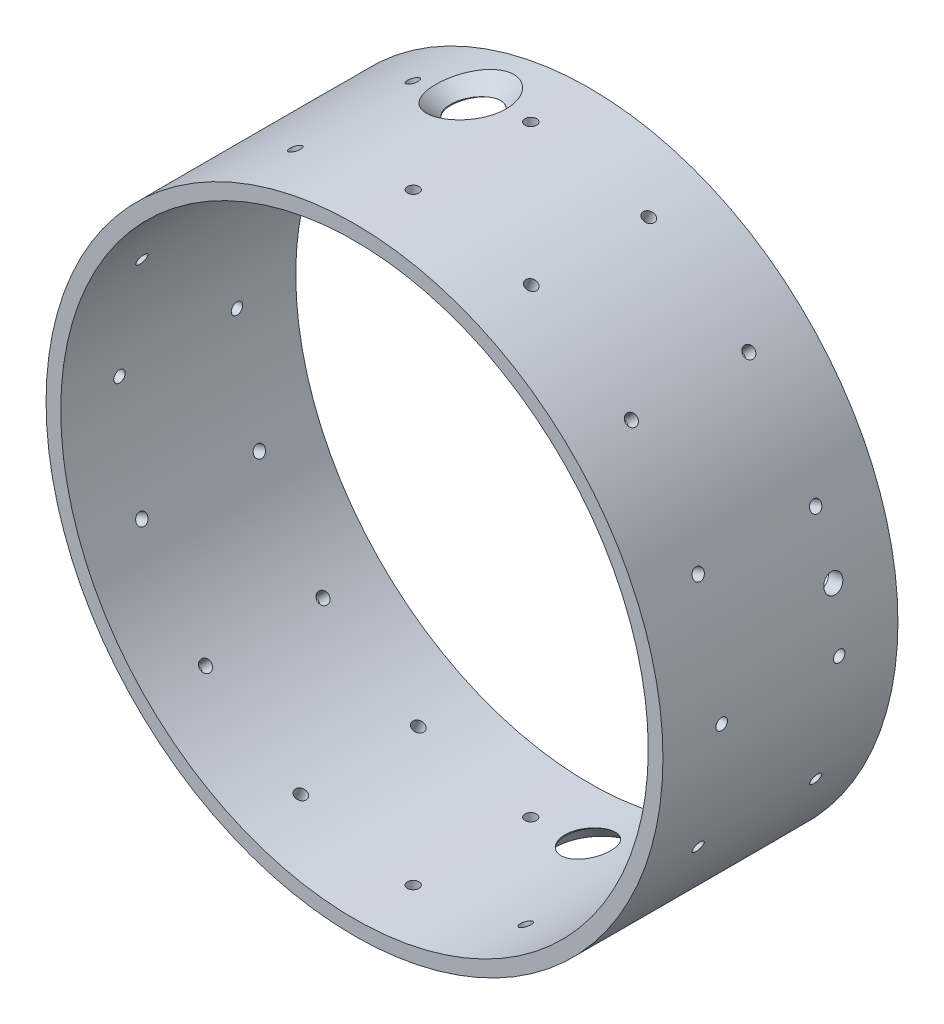
from build123d import *
from build123d.topology import SkipClean

# Parameters (mm, degrees)
SKETCH1_R                            = 66.675
SKETCH1_R_2                          = 63.5
EXTRUDE1_DEPTH                       = 50.8
F_40_0_098_DIAMETER_HOLE2_AT_2_COUNT = 2
F_40_0_098_DIAMETER_HOLE2_AT_2_PITCH = 25.4
CIRPATTERN1_COUNT                    = 16
F_10_32_TAPPED_HOLE1_D               = 4.0386
F_10_32_TAPPED_HOLE1_DEPTH           = 13.716
F_10_32_TAPPED_HOLE1_TIP             = 1.213317848


with BuildPart() as part:
    # Sketch1 → Extrude1 (new body)
    with BuildSketch(Plane.XY):
        Circle(SKETCH1_R)
        Circle(SKETCH1_R_2, mode=Mode.SUBTRACT)
    extrude(amount=EXTRUDE1_DEPTH)

    # Sketch8 → #40 (0.098) Diameter Hole2 (revolve, cut)
    with BuildSketch(Plane(origin=(0, 66.675, 12.7), x_dir=(0, 0, 1), z_dir=(1, 0, 0))):
        Polygon((0, 0), (0, 13.447831126), (1.2446, 12.7), (1.2446, 0), align=None)
    f_40_0_098_diameter_hole2 = revolve(axis=Axis((0, 73.025, 12.7), (0, -1, 0)), mode=Mode.SUBTRACT)

    # #40 (0.098) Diameter Hole2 at 2: #40 (0.098) Diameter Hole2 ×2
    with Locations(*[(0, 0, i * F_40_0_098_DIAMETER_HOLE2_AT_2_PITCH) for i in range(1, F_40_0_098_DIAMETER_HOLE2_AT_2_COUNT)]):
        add(f_40_0_098_diameter_hole2, mode=Mode.SUBTRACT)

    # CirPattern1: #40 (0.098) Diameter Hole2 ×16 about axis
    cirpattern1_axis = Axis((0, 0, 50.8), (0, 0, -1))
    for i in range(1, CIRPATTERN1_COUNT):
        add(f_40_0_098_diameter_hole2.rotate(cirpattern1_axis, i * 360 / CIRPATTERN1_COUNT), mode=Mode.SUBTRACT)

    # CirPattern1 copy 1 sketch → CirPattern1 copy 1 (revolve, cut)
    with BuildSketch(Plane(origin=(25.515417853, 61.59966783, 38.1), x_dir=(0, 0, 1), z_dir=(0.9238795325112867, -0.3826834323650898, 0))):
        Polygon((0, 0), (0, 13.447831126), (1.2446, 12.7), (1.2446, 0), align=None)
    revolve(axis=Axis((27.945457648, 67.466302862, 38.1), (-0.3826834323650898, -0.9238795325112867, 0)), mode=Mode.SUBTRACT)

    # CirPattern1 copy 2 sketch → CirPattern1 copy 2 (revolve, cut)
    with BuildSketch(Plane(origin=(47.146344636, 47.146344636, 38.1), x_dir=(0, 0, 1), z_dir=(0.7071067811865476, -0.7071067811865475, 0))):
        Polygon((0, 0), (0, 13.447831126), (1.2446, 12.7), (1.2446, 0), align=None)
    revolve(axis=Axis((51.636472696, 51.636472696, 38.1), (-0.7071067811865475, -0.7071067811865476, 0)), mode=Mode.SUBTRACT)

    # CirPattern1 copy 3 sketch → CirPattern1 copy 3 (revolve, cut)
    with BuildSketch(Plane(origin=(61.59966783, 25.515417853, 38.1), x_dir=(0, 0, 1), z_dir=(0.38268343236508984, -0.9238795325112867, 0))):
        Polygon((0, 0), (0, 13.447831126), (1.2446, 12.7), (1.2446, 0), align=None)
    revolve(axis=Axis((67.466302862, 27.945457648, 38.1), (-0.9238795325112867, -0.38268343236508984, 0)), mode=Mode.SUBTRACT)

    # CirPattern1 copy 4 sketch → CirPattern1 copy 4 (revolve, cut)
    with BuildSketch(Plane(origin=(66.675, 0, 38.1), x_dir=(0, 0, 1), z_dir=(0, -1, 0))):
        Polygon((0, 0), (0, 13.447831126), (1.2446, 12.7), (1.2446, 0), align=None)
    revolve(axis=Axis((73.025, 0, 38.1), (-1, 0, 0)), mode=Mode.SUBTRACT)

    # CirPattern1 copy 5 sketch → CirPattern1 copy 5 (revolve, cut)
    with BuildSketch(Plane(origin=(61.59966783, -25.515417853, 38.1), x_dir=(0, 0, 1), z_dir=(-0.3826834323650897, -0.9238795325112867, 0))):
        Polygon((0, 0), (0, 13.447831126), (1.2446, 12.7), (1.2446, 0), align=None)
    revolve(axis=Axis((67.466302862, -27.945457648, 38.1), (-0.9238795325112867, 0.3826834323650897, 0)), mode=Mode.SUBTRACT)

    # CirPattern1 copy 6 sketch → CirPattern1 copy 6 (revolve, cut)
    with BuildSketch(Plane(origin=(47.146344636, -47.146344636, 38.1), x_dir=(0, 0, 1), z_dir=(-0.7071067811865475, -0.7071067811865476, 0))):
        Polygon((0, 0), (0, 13.447831126), (1.2446, 12.7), (1.2446, 0), align=None)
    revolve(axis=Axis((51.636472696, -51.636472696, 38.1), (-0.7071067811865476, 0.7071067811865475, 0)), mode=Mode.SUBTRACT)

    # CirPattern1 copy 7 sketch → CirPattern1 copy 7 (revolve, cut)
    with BuildSketch(Plane(origin=(25.515417853, -61.59966783, 38.1), x_dir=(0, 0, 1), z_dir=(-0.9238795325112867, -0.3826834323650899, 0))):
        Polygon((0, 0), (0, 13.447831126), (1.2446, 12.7), (1.2446, 0), align=None)
    revolve(axis=Axis((27.945457648, -67.466302862, 38.1), (-0.3826834323650899, 0.9238795325112867, 0)), mode=Mode.SUBTRACT)

    # CirPattern1 copy 8 sketch → CirPattern1 copy 8 (revolve, cut)
    with BuildSketch(Plane(origin=(0, -66.675, 38.1), x_dir=(0, 0, 1), z_dir=(-1, 0, 0))):
        Polygon((0, 0), (0, 13.447831126), (1.2446, 12.7), (1.2446, 0), align=None)
    revolve(axis=Axis((0, -73.025, 38.1), (0, 1, 0)), mode=Mode.SUBTRACT)

    # CirPattern1 copy 9 sketch → CirPattern1 copy 9 (revolve, cut)
    with BuildSketch(Plane(origin=(-25.515417853, -61.59966783, 38.1), x_dir=(0, 0, 1), z_dir=(-0.9238795325112868, 0.38268343236508967, 0))):
        Polygon((0, 0), (0, 13.447831126), (1.2446, 12.7), (1.2446, 0), align=None)
    revolve(axis=Axis((-27.945457648, -67.466302862, 38.1), (0.38268343236508967, 0.9238795325112868, 0)), mode=Mode.SUBTRACT)

    # CirPattern1 copy 10 sketch → CirPattern1 copy 10 (revolve, cut)
    with BuildSketch(Plane(origin=(-47.146344636, -47.146344636, 38.1), x_dir=(0, 0, 1), z_dir=(-0.7071067811865477, 0.7071067811865475, 0))):
        Polygon((0, 0), (0, 13.447831126), (1.2446, 12.7), (1.2446, 0), align=None)
    revolve(axis=Axis((-51.636472696, -51.636472696, 38.1), (0.7071067811865475, 0.7071067811865477, 0)), mode=Mode.SUBTRACT)

    # CirPattern1 copy 11 sketch → CirPattern1 copy 11 (revolve, cut)
    with BuildSketch(Plane(origin=(-61.59966783, -25.515417853, 38.1), x_dir=(0, 0, 1), z_dir=(-0.3826834323650895, 0.9238795325112868, 0))):
        Polygon((0, 0), (0, 13.447831126), (1.2446, 12.7), (1.2446, 0), align=None)
    revolve(axis=Axis((-67.466302862, -27.945457648, 38.1), (0.9238795325112868, 0.3826834323650895, 0)), mode=Mode.SUBTRACT)

    # CirPattern1 copy 12 sketch → CirPattern1 copy 12 (revolve, cut)
    with BuildSketch(Plane(origin=(-66.675, 0, 38.1), x_dir=(0, 0, 1), z_dir=(0, 1, 0))):
        Polygon((0, 0), (0, 13.447831126), (1.2446, 12.7), (1.2446, 0), align=None)
    revolve(axis=Axis((-73.025, 0, 38.1), (1, 0, 0)), mode=Mode.SUBTRACT)

    # CirPattern1 copy 13 sketch → CirPattern1 copy 13 (revolve, cut)
    with BuildSketch(Plane(origin=(-61.59966783, 25.515417853, 38.1), x_dir=(0, 0, 1), z_dir=(0.38268343236509, 0.9238795325112866, 0))):
        Polygon((0, 0), (0, 13.447831126), (1.2446, 12.7), (1.2446, 0), align=None)
    revolve(axis=Axis((-67.466302862, 27.945457648, 38.1), (0.9238795325112866, -0.38268343236509, 0)), mode=Mode.SUBTRACT)

    # CirPattern1 copy 14 sketch → CirPattern1 copy 14 (revolve, cut)
    with BuildSketch(Plane(origin=(-47.146344636, 47.146344636, 38.1), x_dir=(0, 0, 1), z_dir=(0.7071067811865474, 0.7071067811865477, 0))):
        Polygon((0, 0), (0, 13.447831126), (1.2446, 12.7), (1.2446, 0), align=None)
    revolve(axis=Axis((-51.636472696, 51.636472696, 38.1), (0.7071067811865477, -0.7071067811865474, 0)), mode=Mode.SUBTRACT)

    # CirPattern1 copy 15 sketch → CirPattern1 copy 15 (revolve, cut)
    with BuildSketch(Plane(origin=(-25.515417853, 61.59966783, 38.1), x_dir=(0, 0, 1), z_dir=(0.9238795325112868, 0.38268343236508956, 0))):
        Polygon((0, 0), (0, 13.447831126), (1.2446, 12.7), (1.2446, 0), align=None)
    revolve(axis=Axis((-27.945457648, 67.466302862, 38.1), (0.38268343236508956, -0.9238795325112868, 0)), mode=Mode.SUBTRACT)

    # Sketch14 → 3/8 Clearance Hole1 (revolve, cut)
    with SkipClean():  # the faces are left unmerged after this step: merging them gives an invalid solid
        with BuildSketch(Plane(origin=(-13.00764722, 65.393858571, 12.7), x_dir=(-0.9807852804032303, -0.19509032201612872, 0), z_dir=(0, 0, 1))):
            Polygon((0, 0), (0, 15.983479155), (5.0419, 12.954), (5.0419, 3.175), (8.2169, 0), align=None)
        f_3_8_clearance_hole1 = revolve(axis=Axis((-14.246470765, 71.621845101, 12.7), (0.19509032201612872, -0.9807852804032303, 0)), mode=Mode.SUBTRACT)

    # Mirror1: 3/8 Clearance Hole1 across plane
    with SkipClean():  # the faces are left unmerged after this step: merging them gives an invalid solid
        add(f_3_8_clearance_hole1.mirror(Plane(origin=(0, 0, 12.7), x_dir=(0, 0, 1), z_dir=(-0.19509032201612872, 0.9807852804032303, 0))), mode=Mode.SUBTRACT)

    # #10-32 Tapped Hole1
    with Locations(Plane(origin=(65.393858571, 13.00764722, 12.7), x_dir=(0, 0, -1), z_dir=(0.9807852804032311, 0.19509032201612506, 0))):
        with Locations((0, 0)):
            Hole(F_10_32_TAPPED_HOLE1_D / 2, depth=F_10_32_TAPPED_HOLE1_DEPTH)
            with Locations((0, 0, -(F_10_32_TAPPED_HOLE1_DEPTH + F_10_32_TAPPED_HOLE1_TIP / 2))):  # 118° drill point
                Cone(0, F_10_32_TAPPED_HOLE1_D / 2, F_10_32_TAPPED_HOLE1_TIP, mode=Mode.SUBTRACT)


solid = part.part
